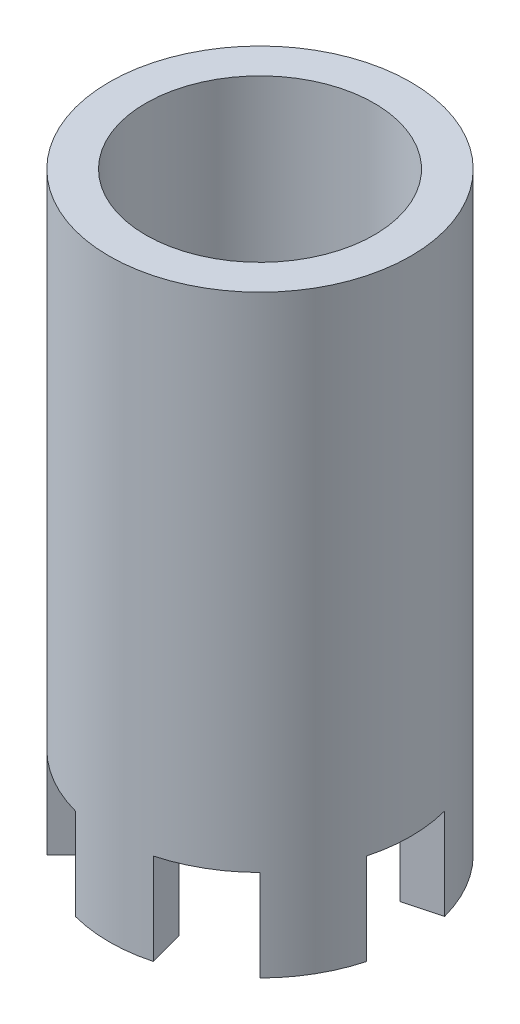
from build123d import *
from build123d.topology import SkipClean

# Parameters (mm, degrees)
SKETCH2_R           = 3.3
SKETCH2_R_2         = 2.5
BOSS_EXTRUDE1_DEPTH = 11
BOSS_EXTRUDE2_START = 2
BOSS_EXTRUDE2_DEPTH = 2


with BuildPart() as part:
    # Sketch2 → Boss-Extrude1 (new body)
    with BuildSketch(Plane(origin=(0, 0, 0), x_dir=(1, 0, 0), z_dir=(0, 1, 0))):
        Circle(SKETCH2_R)
        Circle(SKETCH2_R_2, mode=Mode.SUBTRACT)
    extrude(amount=BOSS_EXTRUDE1_DEPTH)

    # Sketch3 → Boss-Extrude2 (add)
    with SkipClean():  # the faces are left unmerged after this step: merging them gives an invalid solid
        with BuildSketch(Plane.XZ.offset(BOSS_EXTRUDE2_START)):
            with BuildLine():
                Line((-0.647047613, 2.414814566), (-0.854102849, 3.187555227))
                ThreePointArc((-0.854102849, 3.187555227), (0, 3.3), (0.854102849, 3.187555227))
                Line((0.854102849, 3.187555227), (0.647047613, 2.414814566))
                ThreePointArc((0.647047613, 2.414814566), (0, 2.5), (-0.647047613, 2.414814566))
            make_face()
            with BuildLine():
                Line((1.767766953, 1.767766953), (2.333452378, 2.333452378))
                ThreePointArc((2.333452378, 2.333452378), (2.857883832, 1.65), (3.187555227, 0.854102849))
                Line((3.187555227, 0.854102849), (2.414814566, 0.647047613))
                ThreePointArc((2.414814566, 0.647047613), (2.165063509, 1.25), (1.767766953, 1.767766953))
            make_face()
            with BuildLine():
                Line((2.414814566, -0.647047613), (3.187555227, -0.854102849))
                ThreePointArc((3.187555227, -0.854102849), (2.857883832, -1.65), (2.333452378, -2.333452378))
                Line((2.333452378, -2.333452378), (1.767766953, -1.767766953))
                ThreePointArc((1.767766953, -1.767766953), (2.165063509, -1.25), (2.414814566, -0.647047613))
            make_face()
            with BuildLine():
                Line((0.647047613, -2.414814566), (0.854102849, -3.187555227))
                ThreePointArc((0.854102849, -3.187555227), (0, -3.3), (-0.854102849, -3.187555227))
                Line((-0.854102849, -3.187555227), (-0.647047613, -2.414814566))
                ThreePointArc((-0.647047613, -2.414814566), (0, -2.5), (0.647047613, -2.414814566))
            make_face()
            with BuildLine():
                Line((-1.767766953, -1.767766953), (-2.333452378, -2.333452378))
                ThreePointArc((-2.333452378, -2.333452378), (-2.857883832, -1.65), (-3.187555227, -0.854102849))
                Line((-3.187555227, -0.854102849), (-2.414814566, -0.647047613))
                ThreePointArc((-2.414814566, -0.647047613), (-2.165063509, -1.25), (-1.767766953, -1.767766953))
            make_face()
            with BuildLine():
                Line((-2.414814566, 0.647047613), (-3.187555227, 0.854102849))
                ThreePointArc((-3.187555227, 0.854102849), (-2.857883832, 1.65), (-2.333452378, 2.333452378))
                Line((-2.333452378, 2.333452378), (-1.767766953, 1.767766953))
                ThreePointArc((-1.767766953, 1.767766953), (-2.165063509, 1.25), (-2.414814566, 0.647047613))
            make_face()
        extrude(amount=-BOSS_EXTRUDE2_DEPTH)


solid = part.part
